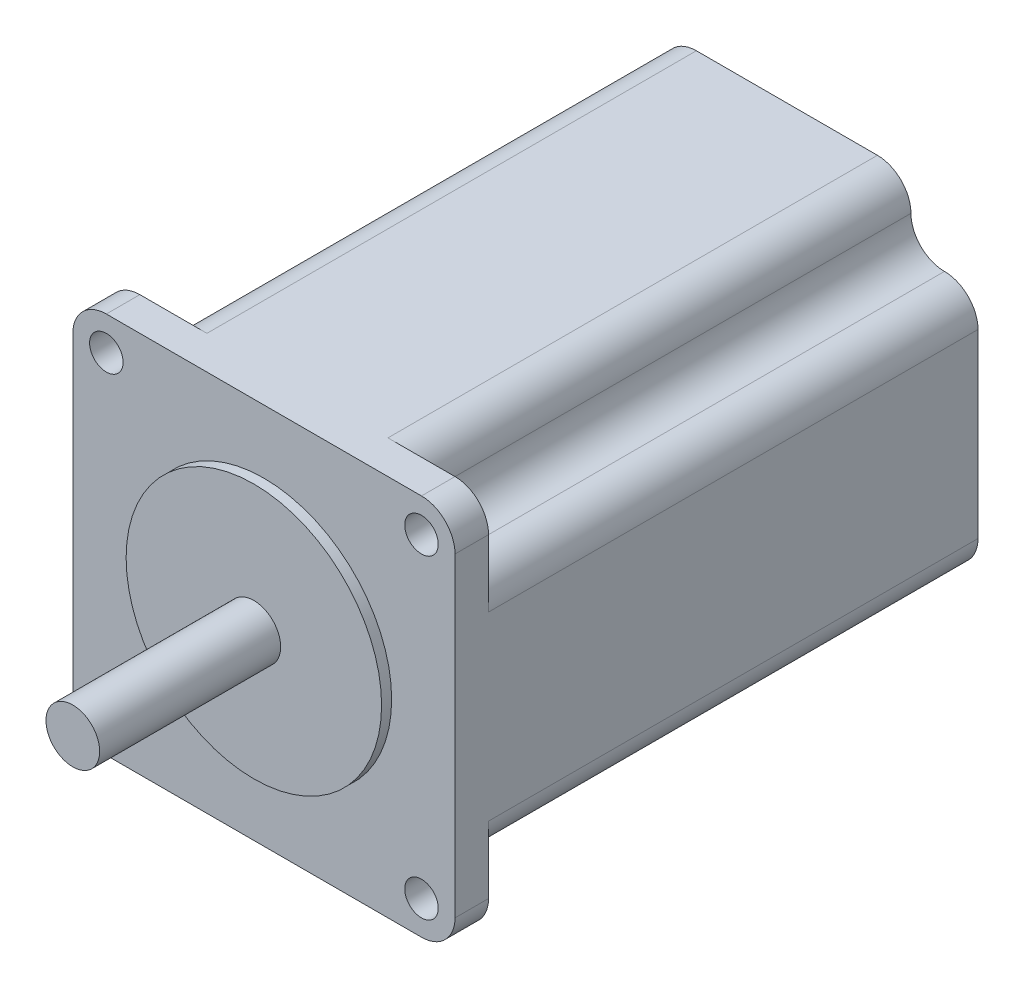
from build123d import *

# Parameters (mm, degrees)
SKETCH1_W            = 57
SKETCH1_H            = 57
BOSS_EXTRUDE1_DEPTH  = 78
SKETCH2_W            = 10
SKETCH2_H            = 10
CUT_EXTRUDE1_DEPTH   = 73
LPATTERN1_COUNT      = 2
LPATTERN1_PITCH      = 47
LPATTERN1_COUNT_DIR2 = 2
LPATTERN1_PITCH_DIR2 = 47
SKETCH3_R            = 2.5
CUT_EXTRUDE2_DEPTH   = 50
LPATTERN2_COUNT      = 2
LPATTERN2_PITCH      = 47
LPATTERN2_COUNT_DIR2 = 2
LPATTERN2_PITCH_DIR2 = 47
FILLET1_R            = 5
SKETCH5_R            = 19.05
BOSS_EXTRUDE3_DEPTH  = 1.5
SKETCH4_R            = 4
BOSS_EXTRUDE2_DEPTH  = 28.5


with BuildPart() as part:
    # Sketch1 → Boss-Extrude1 (new body)
    with BuildSketch(Plane.XY):
        with Locations((-4.861204013, 2.764214047)):
            Rectangle(SKETCH1_W, SKETCH1_H)
    extrude(amount=BOSS_EXTRUDE1_DEPTH)

    # Sketch2 → Cut-Extrude1 (cut)
    with BuildSketch(Plane(origin=(0, 0, 0), x_dir=(-1, 0, 0), z_dir=(0, 0, -1))):
        with Locations((-18.638795987, 26.264214047)):
            Rectangle(SKETCH2_W, SKETCH2_H)
    cut_extrude1 = extrude(amount=-CUT_EXTRUDE1_DEPTH, mode=Mode.SUBTRACT)

    # LPattern1: Cut-Extrude1 2 × 2
    with Locations(*[(-i * LPATTERN1_PITCH, -j * LPATTERN1_PITCH_DIR2, 0) for i in range(LPATTERN1_COUNT) for j in range(LPATTERN1_COUNT_DIR2) if (i, j) != (0, 0)]):
        add(cut_extrude1, mode=Mode.SUBTRACT)

    # Sketch3 → Cut-Extrude2 (cut)
    with BuildSketch(Plane.XY.offset(78)):
        with Locations((-28.361204013, 26.264214047)):
            Circle(SKETCH3_R)
    cut_extrude2 = extrude(amount=-CUT_EXTRUDE2_DEPTH, mode=Mode.SUBTRACT)

    # LPattern2: Cut-Extrude2 2 × 2
    with Locations(*[(i * LPATTERN2_PITCH, -j * LPATTERN2_PITCH_DIR2, 0) for i in range(LPATTERN2_COUNT) for j in range(LPATTERN2_COUNT_DIR2) if (i, j) != (0, 0)]):
        add(cut_extrude2, mode=Mode.SUBTRACT)

    # Fillet1
    fillet1_edges = [part.edges().sort_by_distance(p)[0] for p in [
        (-33.361204013, 21.264214047, 36.5),
        (-23.361204013, 21.264214047, 36.5),
        (-23.361204013, 31.264214047, 36.5),
        (13.638795987, 31.264214047, 36.5),
        (13.638795987, 21.264214047, 36.5),
        (23.638795987, 21.264214047, 36.5),
        (23.638795987, -25.735785953, 75.5),
        (23.638795987, -15.735785953, 36.5),
        (13.638795987, -15.735785953, 36.5),
        (13.638795987, -25.735785953, 36.5),
        (-23.361204013, -25.735785953, 36.5),
        (-23.361204013, -15.735785953, 36.5),
        (-33.361204013, -15.735785953, 36.5),
        (-33.361204013, -25.735785953, 75.5),
        (-33.361204013, 31.264214047, 75.5),
        (23.638795987, 31.264214047, 75.5),
    ]]
    fillet(fillet1_edges, radius=FILLET1_R - 0.0001)  # a hair under: the kernel refuses the full size

    # Sketch5 → Boss-Extrude3 (add)
    with BuildSketch(Plane.XY.offset(78)):
        with Locations((-4.861204013, 2.764214047)):
            Circle(SKETCH5_R)
    extrude(amount=BOSS_EXTRUDE3_DEPTH)

    # Sketch4 → Boss-Extrude2 (add)
    with BuildSketch(Plane.XY.offset(78)):
        with Locations(Location((-4.861204013, 2.764214047, 0), (0, 0, 180))):
            Circle(SKETCH4_R)
    extrude(amount=BOSS_EXTRUDE2_DEPTH)


solid = part.part
